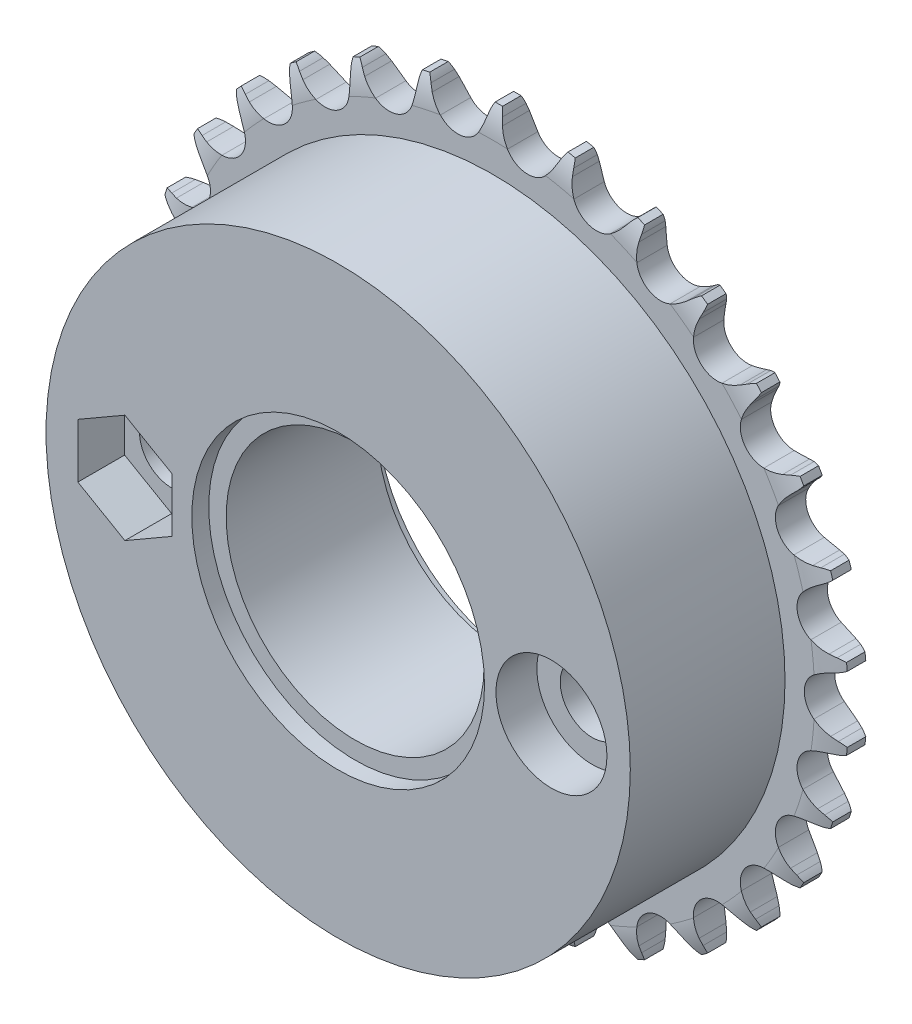
from build123d import *

# Parameters (mm, degrees)
CUT_EXTRUDE1_DEPTH      = 43.93130128
CIRPATTERN1_COUNT       = 30
BOSS_EXTRUDE1_START     = 1.3
SKETCH2_R               = 15
BOSS_EXTRUDE1_DEPTH     = 12.4
CUT_EXTRUDE2_DEPTH      = 45.940072418
CUT_EXTRUDE2_DEPTH_BACK = 45.940072418
SKETCH3_R               = 4
SKETCH4_W               = 1.95
SKETCH4_H               = 5.742776662
CUT_EXTRUDE3_DEPTH      = 45.940072418
CUT_EXTRUDE3_DEPTH_BACK = 45.940072418
SKETCH5_OUTSIDE_W       = 79.754
SKETCH5_OUTSIDE_H       = 80.068
SKETCH5_OUTSIDE_R       = 29.95
SKETCH7_R               = 25
BOSS_EXTRUDE3_DEPTH     = 13.24
CUT_EXTRUDE4_DEPTH      = 45.693343982
CUT_EXTRUDE4_DEPTH_BACK = 45.693343982
SKETCH8_R               = 11.0375
SKETCH9_R               = 12.525
CUT_EXTRUDE5_DEPTH      = 1.45
CUT_EXTRUDE7_DEPTH      = 45.693343982
CUT_EXTRUDE7_DEPTH_BACK = 45.693343982
SKETCH11_R              = 2.75
SKETCH12_R              = 4.75
CUT_EXTRUDE8_DEPTH      = 3.5
CUT_EXTRUDE9_DEPTH      = 4
CUT_EXTRUDE12_START     = -1.45
SKETCH16_R              = 12.525
CUT_EXTRUDE12_DEPTH     = 1.45
SKETCH17_R              = 4.75
CUT_EXTRUDE13_DEPTH     = 3.5
CUT_EXTRUDE14_DEPTH     = 4


with BuildPart() as part:
    # Sketch1 → Revolve1 (revolve)
    with BuildSketch(Plane(origin=(0, 0, 0), x_dir=(0, 0, -1), z_dir=(1, 0, 0))):
        with BuildLine():
            Line((1.3, 0), (-1.3, 0))
            Line((-1.3, 0), (-1.3, 27.530621141))
            ThreePointArc((-1.3, 27.530621141), (-1.122370651, 28.979758815), (-0.6, 30.343093363))
            Line((-0.6, 30.343093363), (0.6, 30.343093363))
            ThreePointArc((0.6, 30.343093363), (1.122370651, 28.979758815), (1.3, 27.530621141))
            Line((1.3, 27.530621141), (1.3, 0))
        make_face()
    revolve(axis=Axis((0, 0, -1.3), (0, 0, 1)))

    # Sketch0 → Cut-Extrude1 (cut, symmetric)
    with BuildSketch(Plane.XY):
        with BuildLine():
            Line((5.58876027, -28.842280787), (5.341291361, -28.353788773))
            ThreePointArc((5.341291361, -28.353788773), (4.962159599, -27.72030576), (4.497885516, -27.146292521))
            ThreePointArc((4.497885516, -27.146292521), (2.785915254, -26.506213069), (1.244435651, -27.488243881))
            ThreePointArc((1.244435651, -27.488243881), (0.909651135, -28.146241563), (0.670512835, -28.844707378))
            Line((0.670512835, -28.844707378), (0.530014917, -29.373976348))
            ThreePointArc((0.530014917, -29.373976348), (-0.744172098, -31.197007964), (-2.893772448, -31.768160441))
            ThreePointArc((-2.893772448, -31.768160441), (3.334425107, -31.724935713), (9.435508528, -30.472300793))
            ThreePointArc((9.435508528, -30.472300793), (7.214132826, -30.360556411), (5.58876027, -28.842280787))
        make_face()
    cut_extrude1 = extrude(amount=CUT_EXTRUDE1_DEPTH, both=True, mode=Mode.SUBTRACT)

    # CirPattern1: Cut-Extrude1 ×30 about axis
    cirpattern1_axis = Axis((0, 0, 0), (0, 0, 1))
    for i in range(1, CIRPATTERN1_COUNT):
        add(cut_extrude1.rotate(cirpattern1_axis, i * 360 / CIRPATTERN1_COUNT), mode=Mode.SUBTRACT)

    # Sketch2 → Boss-Extrude1 (add)
    with BuildSketch(Plane.XY.offset(BOSS_EXTRUDE1_START)):
        with Locations(Location((0, 0, 0), (0, 0, 270))):
            Circle(SKETCH2_R)
    extrude(amount=BOSS_EXTRUDE1_DEPTH)

    # Sketch3 → Cut-Extrude2 (cut, two sides: drawn at the far end of the back side and taken through both)
    with BuildSketch(Plane.XY.offset(-CUT_EXTRUDE2_DEPTH_BACK)):
        with Locations(Location((0, 0, 0), (0, 0, 90))):
            Circle(SKETCH3_R)
    extrude(amount=CUT_EXTRUDE2_DEPTH + CUT_EXTRUDE2_DEPTH_BACK, mode=Mode.SUBTRACT)

    # Sketch4 → Cut-Revolve1 (revolve, cut)
    with BuildSketch(Plane(origin=(0, 0, 0), x_dir=(0, 0, -1), z_dir=(1, 0, 0))):
        Polygon((-13.7, 15), (-13.7, 14.5), (-13.2, 15), align=None)
        with Locations((-2.275, 27.471705032)):
            Rectangle(SKETCH4_W, SKETCH4_H)
    revolve(axis=Axis((0, 0, -1.3), (0, 0, 1)), mode=Mode.SUBTRACT)

    # Sketch5 outside → Cut-Extrude3 (cut, two sides: drawn at the far end of the back side and taken through both)
    with BuildSketch(Plane.XY.offset(-CUT_EXTRUDE3_DEPTH_BACK)):
        Rectangle(SKETCH5_OUTSIDE_W, SKETCH5_OUTSIDE_H)
        Circle(SKETCH5_OUTSIDE_R, mode=Mode.SUBTRACT)
    extrude(amount=CUT_EXTRUDE3_DEPTH + CUT_EXTRUDE3_DEPTH_BACK, mode=Mode.SUBTRACT)

    # Sketch7 → Boss-Extrude3 (add)
    with BuildSketch(Plane.XY.offset(1.3)):
        Circle(SKETCH7_R)
    extrude(amount=BOSS_EXTRUDE3_DEPTH)

    # Sketch8 → Cut-Extrude4 (cut, two sides: drawn at the far end of the back side and taken through both)
    with BuildSketch(Plane.XY.offset(-CUT_EXTRUDE4_DEPTH_BACK)):
        Circle(SKETCH8_R)
    extrude(amount=CUT_EXTRUDE4_DEPTH + CUT_EXTRUDE4_DEPTH_BACK, mode=Mode.SUBTRACT)

    # Sketch9 → Cut-Extrude5 (cut)
    with BuildSketch(Plane.XY.offset(14.54)):
        Circle(SKETCH9_R)
    extrude(amount=-CUT_EXTRUDE5_DEPTH, mode=Mode.SUBTRACT)

    # Sketch11 → Cut-Extrude7 (cut, two sides: drawn at the far end of the back side and taken through both)
    with BuildSketch(Plane.XY.offset(-CUT_EXTRUDE7_DEPTH_BACK)):
        with Locations((18.25, 0)):
            Circle(SKETCH11_R)
        with Locations(Location((-18.25, 0, 0), (0, 0, 90))):
            Circle(SKETCH11_R)
    extrude(amount=CUT_EXTRUDE7_DEPTH + CUT_EXTRUDE7_DEPTH_BACK, mode=Mode.SUBTRACT)

    # Sketch12 → Cut-Extrude8 (cut)
    with BuildSketch(Plane.XY.offset(14.54)):
        with Locations((18.25, 0)):
            Circle(SKETCH12_R)
    extrude(amount=-CUT_EXTRUDE8_DEPTH, mode=Mode.SUBTRACT)

    # Sketch13 → Cut-Extrude9 (cut)
    with BuildSketch(Plane.XY.offset(14.54)):
        Polygon((-18.25, 4.647669667), (-22.275, 2.323834833), (-22.275, -2.323834833), (-18.25, -4.647669667), (-14.225, -2.323834833), (-14.225, 2.323834833), align=None)
    extrude(amount=-CUT_EXTRUDE9_DEPTH, mode=Mode.SUBTRACT)

    # Sketch16 → Cut-Extrude12 (cut)
    with BuildSketch(Plane(origin=(0, 0, -1.3), x_dir=(-1, 0, 0), z_dir=(0, 0, -1)).offset(CUT_EXTRUDE12_START)):
        with Locations(Location((0, 0, 0), (0, 0, 180))):
            Circle(SKETCH16_R)
    extrude(amount=CUT_EXTRUDE12_DEPTH, mode=Mode.SUBTRACT)

    # Sketch17 → Cut-Extrude13 (cut)
    with BuildSketch(Plane(origin=(0, 0, -1.3), x_dir=(-1, 0, 0), z_dir=(0, 0, -1))):
        with Locations(Location((18.25, 0, 0), (0, 0, 90))):
            Circle(SKETCH17_R)
    extrude(amount=-CUT_EXTRUDE13_DEPTH, mode=Mode.SUBTRACT)

    # Sketch18 → Cut-Extrude14 (cut)
    with BuildSketch(Plane(origin=(0, 0, -1.3), x_dir=(-1, 0, 0), z_dir=(0, 0, -1))):
        Polygon((-18.25, 4.647669667), (-22.275, 2.323834833), (-22.275, -2.323834833), (-18.25, -4.647669667), (-14.225, -2.323834833), (-14.225, 2.323834833), align=None)
    extrude(amount=-CUT_EXTRUDE14_DEPTH, mode=Mode.SUBTRACT)


solid = part.part
